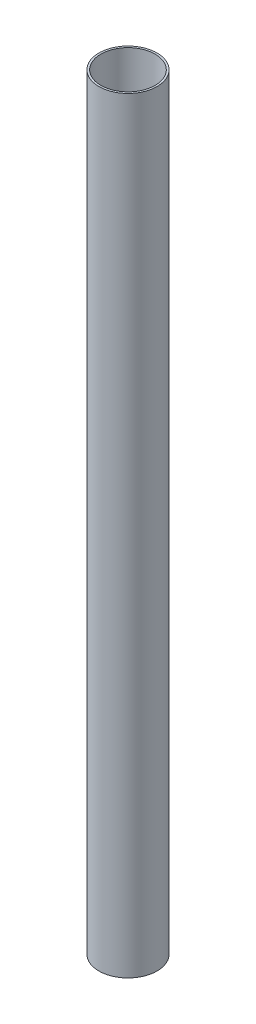
from build123d import *

# Parameters (mm, degrees)
SKETCH1_W = 1.9304
SKETCH1_H = 762


with BuildPart() as part:
    # Sketch1 → Revolve1 (revolve)
    with BuildSketch(Plane.XY):
        with Locations((27.9527, -343.794509568)):
            Rectangle(SKETCH1_W, SKETCH1_H)
    revolve(axis=Axis((0, 0, 0), (0, -1, 0)))


solid = part.part
